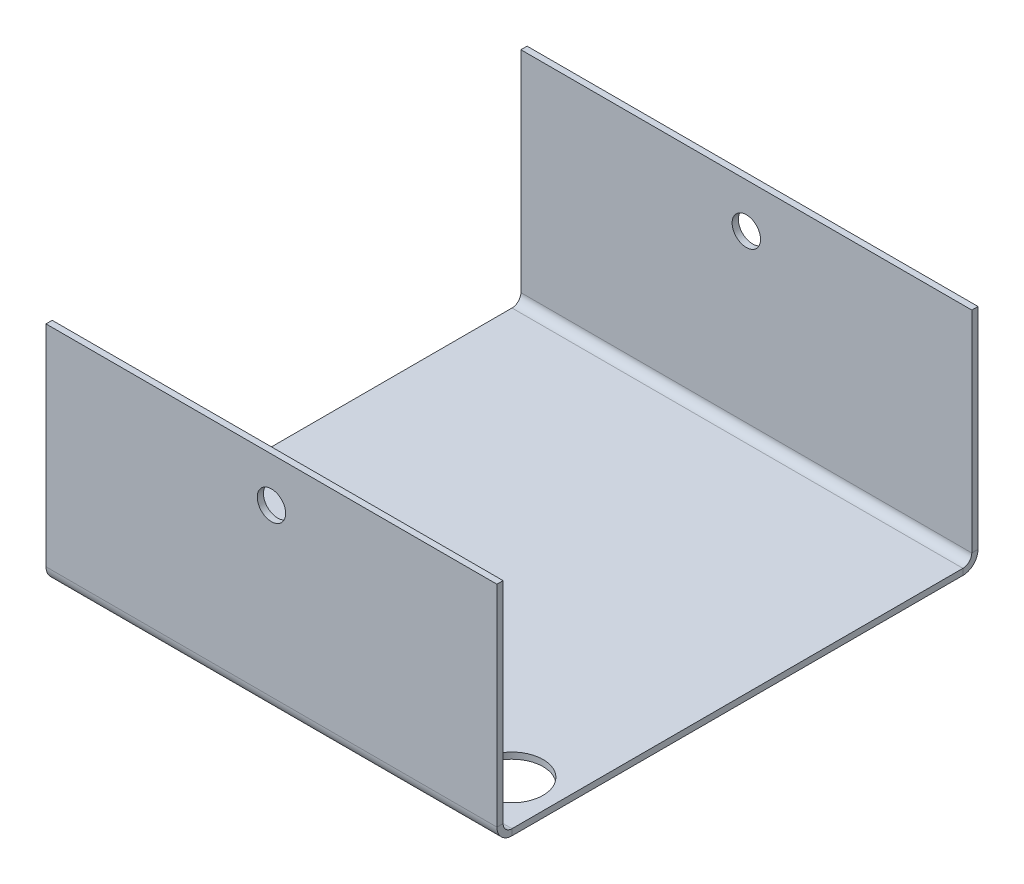
from build123d import *

# Parameters (mm, degrees)
SKETCH1_W               = 50.8
SKETCH1_H               = 50.8
BASE_FLANGE1_DEPTH      = 0.7
EDGE_FLANGE1_DEPTH      = 50.8
EDGE_FLANGE1_BEND_DEPTH = 50.8
SKETCH12_R              = 3.5
CUT_EXTRUDE1_DEPTH      = 45.605605029
SKETCH13_R              = 1
CUT_EXTRUDE2_DEPTH      = 45.605605029
SKETCH14_R              = 1.6
CUT_EXTRUDE3_DEPTH      = 65.752528908


# Sheet-metal steps are written as plain solids
with BuildPart() as part:
    # Sketch1 → Base-Flange1 (new body)
    with BuildSketch(Plane(origin=(0, 0, 0), x_dir=(1, 0, 0), z_dir=(0, 1, 0))):
        Rectangle(SKETCH1_W, SKETCH1_H)
    extrude(amount=-BASE_FLANGE1_DEPTH)

    # Edge-Flange1 section (across the edge) → Edge-Flange1 (add)
    with BuildSketch(Plane(origin=(25.4, 0, -26.4), x_dir=(0, 0, 1), z_dir=(-1, 0, 0))):
        with BuildLine():
            Line((-0.7, 1), (-0.7, 24.7))
            Line((-0.7, 24.7), (0, 24.7))
            Line((0, 24.7), (0, 1))
            ThreePointArc((0, 1), (0.292893219, 0.292893219), (1, 0))
            Line((1, 0), (1, -0.7))
            ThreePointArc((1, -0.7), (-0.202081528, -0.202081528), (-0.7, 1))
        make_face()
    extrude(amount=EDGE_FLANGE1_DEPTH)

    # Edge-Flange1 section 2 (across the edge) → Edge-Flange1 bend (add)
    with BuildSketch(Plane(origin=(-25.4, 0, 26.4), x_dir=(0, 0, -1), z_dir=(1, 0, 0))):
        with BuildLine():
            Line((-0.7, 1), (-0.7, 24.7))
            Line((-0.7, 24.7), (0, 24.7))
            Line((0, 24.7), (0, 1))
            ThreePointArc((0, 1), (0.292893219, 0.292893219), (1, 0))
            Line((1, 0), (1, -0.7))
            ThreePointArc((1, -0.7), (-0.202081528, -0.202081528), (-0.7, 1))
        make_face()
    extrude(amount=EDGE_FLANGE1_BEND_DEPTH)

    # Sketch12 → Cut-Extrude1 (cut, through all)
    with BuildSketch(Plane(origin=(0, 0, 0), x_dir=(1, 0, 0), z_dir=(0, 1, 0))):
        with Locations(Location((20.4, -20.4, 0), (0, 0, 270))):
            Circle(SKETCH12_R)
    extrude(amount=-CUT_EXTRUDE1_DEPTH, mode=Mode.SUBTRACT)

    # Sketch13 → Cut-Extrude2 (cut, through all)
    with BuildSketch(Plane(origin=(0, 0, 0), x_dir=(1, 0, 0), z_dir=(0, 1, 0))):
        with Locations(Location((1.4, -20.4, 0), (0, 0, 270))):
            Circle(SKETCH13_R)
    extrude(amount=-CUT_EXTRUDE2_DEPTH, mode=Mode.SUBTRACT)

    # Sketch14 → Cut-Extrude3 (cut, through all)
    with BuildSketch(Plane.XY.offset(27.1)):
        with Locations((0, 19.7)):
            Circle(SKETCH14_R)
    extrude(amount=-CUT_EXTRUDE3_DEPTH, mode=Mode.SUBTRACT)


solid = part.part
